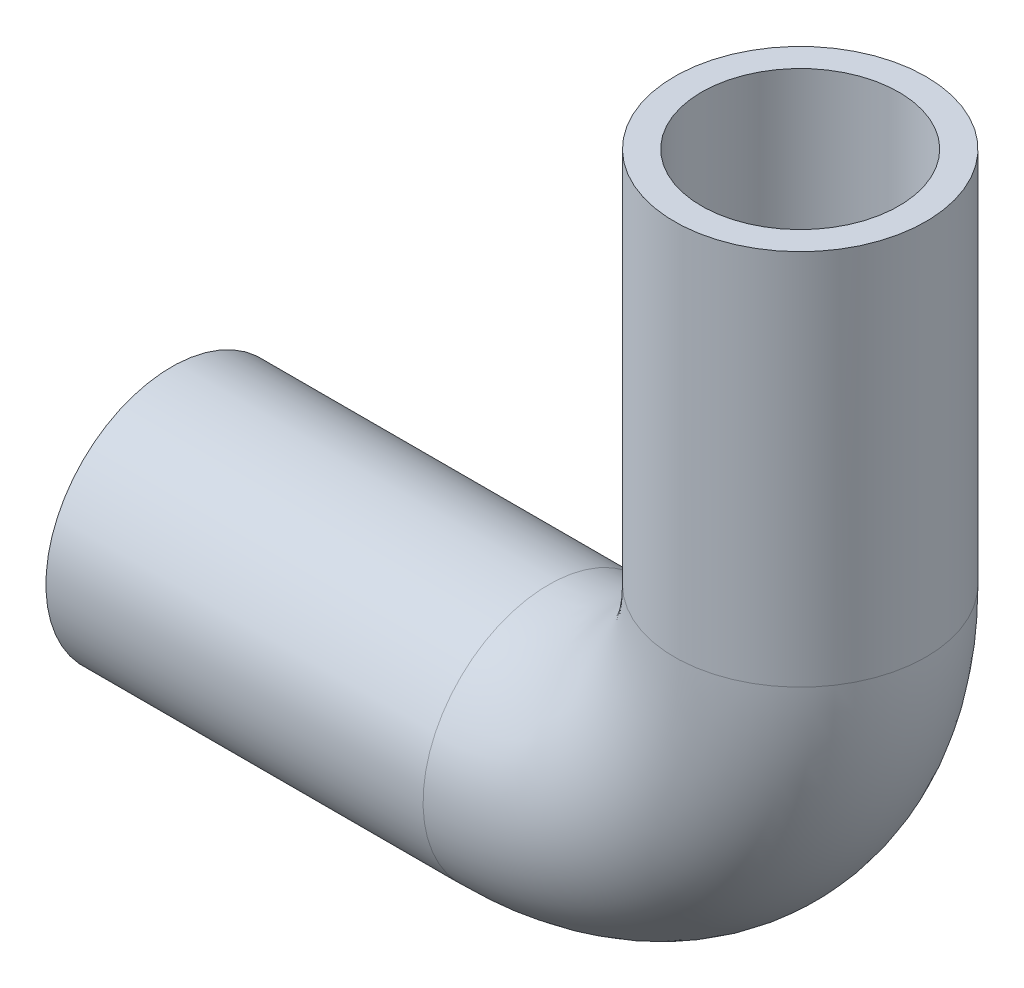
from build123d import *

# Parameters (mm, degrees)
SWEEP_START         = 9.9999999
SWEEP_1_OUTLINE_R   = 5
SWEEP_1_DEPTH       = 15.0000001
SWEEP_START_2       = -25
SWEEP_1_2_OUTLINE_R = 5
SWEEP_1_2_DEPTH     = 15
SWEEP_1_3_OUTLINE_R = 5
SWEEP_1_3_ANGLE     = 90
SKETCH_2_R          = 3.924596356


with BuildPart() as part:
    # Sweep 1: read off the stored shape, not the designer's step
    # Sweep 1 outline → Sweep 1 (new body)
    with BuildSketch(Plane(origin=(0, 0, 0), x_dir=(1, 0, 0), z_dir=(0, 1, 0)).offset(SWEEP_START)):
        Circle(SWEEP_1_OUTLINE_R)
    extrude(amount=SWEEP_1_DEPTH)



with BuildPart() as body_2:
    # Sweep 1 2 outline → Sweep 1 2 (new body)
    with BuildSketch(Plane.YZ.offset(SWEEP_START_2)):
        Circle(SWEEP_1_2_OUTLINE_R)
    extrude(amount=SWEEP_1_2_DEPTH)


with BuildPart() as part_1:
    add(part.part)

    add(body_2.part)  # Sweep 1 3 merges body 2
    # Sweep 1 3 outline → Sweep 1 3 (revolve)
    with BuildSketch(Plane(origin=(-10, 10, 0), x_dir=(0, -1, 0), z_dir=(-1, 0, 0))):
        with Locations((10, 0)):
            Circle(SWEEP_1_3_OUTLINE_R)
    revolve(axis=Axis((-10, 10, 0), (0, 0, 1)), revolution_arc=SWEEP_1_3_ANGLE)

    # Sweep 1 4: sweep along a path in 草图4
    with BuildLine(Plane.XY) as sweep_1_4_path:
        Line((0, 25.105232373), (0, 10))
        ThreePointArc((0, 10), (-2.928932188, 2.928932188), (-10, 0))
        Line((-10, 0), (-25, 0))
    # 草图2 → Sweep 1 4 (sweep, cut)
    with BuildSketch(Plane.ZY.offset(25)):
        Circle(SKETCH_2_R)
    sweep(path=sweep_1_4_path.line, mode=Mode.SUBTRACT)


solid = part_1.part
